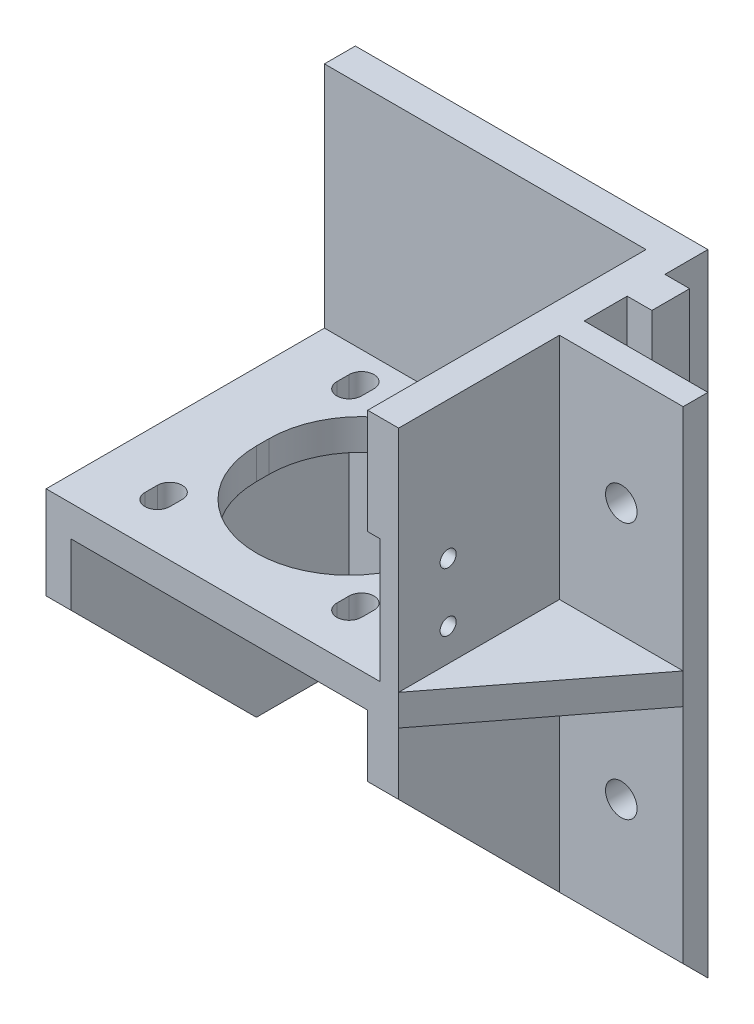
from build123d import *

# Parameters (mm, degrees)
SKETCH_1_W           = 57
SKETCH_1_H           = 50
EXTRUDE_1_DEPTH      = 5
EXTRUDE_3_DEPTH      = 30
EXTRUDE_4_DEPTH      = 40
CUT_EXTRUDE_1_DEPTH  = 80
SKETCH_6_R           = 15
CUT_EXTRUDE_2_DEPTH  = 80
SKETCH_7_R           = 3
CUT_EXTRUDE_6_DEPTH  = 80
SKETCH_8_W           = 6.1
SKETCH_8_H           = 75
EXTRUDE_5_DEPTH      = 4
EXTRUDE_6_DEPTH      = 20
SKETCH_10_W          = 20
SKETCH_10_H          = 5
EXTRUDE_7_DEPTH      = 26
CUT_EXTRUDE_7_DEPTH  = 26
EXTRUDE_8_DEPTH      = 7
SKETCH_15_R          = 2.55
CUT_EXTRUDE_9_DEPTH  = 7
SKETCH_16_W          = 5.535203569
SKETCH_16_H          = 7.819573295
SKETCH_16_W_2        = 5.974505439
SKETCH_16_H_2        = 8.127084604
SKETCH_16_W_3        = 7.643852547
SKETCH_16_H_3        = 8.522456287
SKETCH_16_W_4        = 7.380271425
SKETCH_16_H_4        = 8.083154417
EXTRUDE_9_DEPTH      = 5
CUT_EXTRUDE_10_DEPTH = 5
CUT_EXTRUDE_11_DEPTH = 5
SKETCH_19_R          = 3.05
CUT_EXTRUDE_12_DEPTH = 10
SKETCH_21_W          = 77
SKETCH_21_H          = 82
CUT_EXTRUDE_13_DEPTH = 50
SKETCH_22_W          = 80.624426437
SKETCH_22_H          = 78
CUT_EXTRUDE_14_DEPTH = 50
CUT_EXTRUDE_15_DEPTH = 10
SKETCH_24_W          = 2
SKETCH_24_H          = 20
CUT_EXTRUDE_16_DEPTH = 15
SKETCH_25_R          = 1.3
CUT_EXTRUDE_17_DEPTH = 15


with BuildPart() as part:
    # 草图1 → 凸台-拉伸1 (new body)
    with BuildSketch(Plane(origin=(0, 0, 0), x_dir=(1, 0, 0), z_dir=(0, 1, 0))):
        Rectangle(SKETCH_1_W, SKETCH_1_H)
    extrude_1 = extrude(amount=EXTRUDE_1_DEPTH)

    # 草图2 → 凸台-拉伸3 (add)
    with BuildSketch(Plane(origin=(0, 5, 0), x_dir=(1, 0, 0), z_dir=(0, 1, 0))):
        Polygon((-28.5, -25), (-23.5, -25), (-23.5, 20), (28.5, 20), (28.5, 25), (-28.5, 25), align=None)
    extrude_3 = extrude(amount=EXTRUDE_3_DEPTH)

    # 草图3 → 凸台-拉伸4 (add)
    with BuildSketch(Plane.XZ):
        Polygon((-28.5, -25), (28.5, -25), (28.5, 25), (24.5, 25), (24.5, -20), (-23.5, -20), (-23.5, 25), (-28.5, 25), align=None)
    extrude_4 = extrude(amount=EXTRUDE_4_DEPTH)

    # 草图5 → 切除-拉伸1 (cut)
    with BuildSketch(Plane(origin=(28.5, 0, 0), x_dir=(0, 0, -1), z_dir=(1, 0, 0))):
        Polygon((-25, -10), (5, -40), (-25, -40), align=None)
    cut_extrude_1 = extrude(amount=-CUT_EXTRUDE_1_DEPTH, mode=Mode.SUBTRACT)

    # 草图6 → 切除-拉伸2 (cut)
    with BuildSketch(Plane(origin=(0, 5, 0), x_dir=(1, 0, 0), z_dir=(0, 1, 0))):
        with BuildLine():
            Line((20.5, -19), (20.5, -17))
            ThreePointArc((20.5, -17), (18.5, -15), (16.5, -17))
            Line((16.5, -17), (16.5, -19))
            ThreePointArc((16.5, -19), (18.5, -21), (20.5, -19))
        make_face()
        with Locations((2.5, -1)):
            Circle(SKETCH_6_R)
        with BuildLine():
            Line((-15.5, -17), (-15.5, -19))
            ThreePointArc((-15.5, -19), (-13.5, -21), (-11.5, -19))
            Line((-11.5, -19), (-11.5, -17))
            ThreePointArc((-11.5, -17), (-13.5, -15), (-15.5, -17))
        make_face()
        with BuildLine():
            ThreePointArc((20.5, 13), (18.5, 15), (16.5, 13))
            Line((16.5, 13), (16.5, 11))
            ThreePointArc((16.5, 11), (18.5, 9), (20.5, 11))
            Line((20.5, 11), (20.5, 13))
        make_face()
        with BuildLine():
            Line((-11.5, 11), (-11.5, 13))
            ThreePointArc((-11.5, 13), (-13.5, 15), (-15.5, 13))
            Line((-15.5, 13), (-15.5, 11))
            ThreePointArc((-15.5, 11), (-13.5, 9), (-11.5, 11))
        make_face()
    extrude(amount=-CUT_EXTRUDE_2_DEPTH, mode=Mode.SUBTRACT)

    # 草图7 → 切除-拉伸6 (cut)
    with BuildSketch(Plane.XY.offset(-20)):
        with Locations((-15.5, 17)):
            Circle(SKETCH_7_R)
    extrude(amount=-CUT_EXTRUDE_6_DEPTH, mode=Mode.SUBTRACT)

    # 草图8 → 凸台-拉伸5 (add)
    with BuildSketch(Plane.ZY.offset(28.5)):
        with Locations((-15, -2.5)):
            Rectangle(SKETCH_8_W, SKETCH_8_H)
    extrude_5 = extrude(amount=EXTRUDE_5_DEPTH)

    # 草图9 → 凸台-拉伸6 (add)
    with BuildSketch(Plane.ZY.offset(28.5)):
        Polygon((-5, -40), (-5, 35), (-1, 35), (-1, -36), align=None)
    extrude_6 = extrude(amount=EXTRUDE_6_DEPTH)

    # 草图10 → 凸台-拉伸7 (add)
    with BuildSketch(Plane.XY.offset(-1)):
        with Locations((-38.5, 2.5)):
            Rectangle(SKETCH_10_W, SKETCH_10_H)
    extrude_7 = extrude(amount=EXTRUDE_7_DEPTH)

    # 草图11 → 切除-拉伸7 (cut)
    with BuildSketch(Plane.XZ):
        Polygon((-48.5, 25), (-48.5, -1), (-28.5, 25), align=None)
    cut_extrude_7 = extrude(amount=-CUT_EXTRUDE_7_DEPTH, mode=Mode.SUBTRACT)

    # 草图14 → 凸台-拉伸8 (add)
    with BuildSketch(Plane(origin=(0, 35, 0), x_dir=(1, 0, 0), z_dir=(0, 1, 0))):
        Polygon((28.5, 25), (-28.5, 25), (-28.5, 18.05), (-32.5, 18.05), (-32.5, 11.95), (-28.5, 11.95), (-28.5, 5), (-48.5, 5), (-48.5, 1), (-28.5, 1), (-28.5, -25), (-23.5, -25), (-23.5, 20), (28.5, 20), align=None)
    extrude_8 = extrude(amount=EXTRUDE_8_DEPTH)

    # 草图15 → 切除-拉伸9 (cut)
    with BuildSketch(Plane.XY.offset(-1)):
        with Locations((-38.5, 23.5)):
            Circle(SKETCH_15_R)
        with Locations((-38.5, -18)):
            Circle(SKETCH_15_R)
    cut_extrude_9 = extrude(amount=-CUT_EXTRUDE_9_DEPTH, mode=Mode.SUBTRACT)

    # 草图16 → 凸台-拉伸9 (add)
    with BuildSketch(Plane(origin=(0, 5, 0), x_dir=(1, 0, 0), z_dir=(0, 1, 0))):
        with Locations((-13.755717979, 12.566621799)):
            Rectangle(SKETCH_16_W, SKETCH_16_H)
        with Locations((-13.975368915, -17.503591238)):
            Rectangle(SKETCH_16_W_2, SKETCH_16_H_2)
        with Locations((18.884411, -17.70127708)):
            Rectangle(SKETCH_16_W_3, SKETCH_16_H_3)
        with Locations((18.752620439, 12.69841236)):
            Rectangle(SKETCH_16_W_4, SKETCH_16_H_4)
    extrude(amount=-EXTRUDE_9_DEPTH)

    # 草图17 → 切除-拉伸10 (cut)
    with BuildSketch(Plane(origin=(0, 5, 0), x_dir=(1, 0, 0), z_dir=(0, 1, 0))):
        with BuildLine():
            Line((17, 15.5), (17, 13.5))
            ThreePointArc((17, 13.5), (18, 12.5), (19, 13.5))
            Line((19, 13.5), (19, 15.5))
            ThreePointArc((19, 15.5), (18, 16.5), (17, 15.5))
        make_face()
        with BuildLine():
            Line((-14, 15.5), (-14, 13.5))
            ThreePointArc((-14, 13.5), (-13, 12.5), (-12, 13.5))
            Line((-12, 13.5), (-12, 15.5))
            ThreePointArc((-12, 15.5), (-13, 16.5), (-14, 15.5))
        make_face()
        with BuildLine():
            Line((17, -15.5), (17, -17.5))
            ThreePointArc((17, -17.5), (18, -18.5), (19, -17.5))
            Line((19, -17.5), (19, -15.5))
            ThreePointArc((19, -15.5), (18, -14.5), (17, -15.5))
        make_face()
        with BuildLine():
            Line((-14, -15.5), (-14, -17.5))
            ThreePointArc((-14, -17.5), (-13, -18.5), (-12, -17.5))
            Line((-12, -17.5), (-12, -15.5))
            ThreePointArc((-12, -15.5), (-13, -14.5), (-14, -15.5))
        make_face()
    cut_extrude_10 = extrude(amount=-CUT_EXTRUDE_10_DEPTH, mode=Mode.SUBTRACT)

    # 草图18 → 切除-拉伸11 (cut)
    with BuildSketch(Plane(origin=(0, 5, 0), x_dir=(1, 0, 0), z_dir=(0, 1, 0))):
        with BuildLine():
            Line((-12.5, -1), (-12.5, 0))
            ThreePointArc((-12.5, 0), (2.5, 15), (17.5, 0))
            Line((17.5, 0), (17.5, -1))
            Line((17.5, -1), (17.5, -2))
            ThreePointArc((17.5, -2), (2.5, -17), (-12.5, -2))
            Line((-12.5, -2), (-12.5, -1))
        make_face()
    cut_extrude_11 = extrude(amount=-CUT_EXTRUDE_11_DEPTH, mode=Mode.SUBTRACT)

    # 草图19 → 切除-拉伸12 (cut)
    with BuildSketch(Plane(origin=(0, 0, -25), x_dir=(-1, 0, 0), z_dir=(0, 0, -1))):
        with Locations((15.5, 17)):
            Circle(SKETCH_19_R)
    cut_extrude_12 = extrude(amount=-CUT_EXTRUDE_12_DEPTH, mode=Mode.SUBTRACT)

    # 镜向3: 凸台-拉伸1, 凸台-拉伸3, 凸台-拉伸4, 切除-拉伸1, 凸台-拉伸5, 凸台-拉伸6, 凸台-拉伸7, 切除-拉伸7, 凸台-拉伸8, 切除-拉伸9, 切除-拉伸10, 切除-拉伸11, 切除-拉伸12 across plane
    add(extrude_1.mirror(Plane(origin=(28.5, 5, 25), x_dir=(0, 0, 1), z_dir=(-1, 0, 0))))
    add(extrude_3.mirror(Plane(origin=(28.5, 5, 25), x_dir=(0, 0, 1), z_dir=(-1, 0, 0))))
    add(extrude_4.mirror(Plane(origin=(28.5, 5, 25), x_dir=(0, 0, 1), z_dir=(-1, 0, 0))))
    add(cut_extrude_1.mirror(Plane(origin=(28.5, 5, 25), x_dir=(0, 0, 1), z_dir=(-1, 0, 0))), mode=Mode.SUBTRACT)
    add(extrude_5.mirror(Plane(origin=(28.5, 5, 25), x_dir=(0, 0, 1), z_dir=(-1, 0, 0))))
    add(extrude_6.mirror(Plane(origin=(28.5, 5, 25), x_dir=(0, 0, 1), z_dir=(-1, 0, 0))))
    add(extrude_7.mirror(Plane(origin=(28.5, 5, 25), x_dir=(0, 0, 1), z_dir=(-1, 0, 0))))
    add(cut_extrude_7.mirror(Plane(origin=(28.5, 5, 25), x_dir=(0, 0, 1), z_dir=(-1, 0, 0))), mode=Mode.SUBTRACT)
    add(extrude_8.mirror(Plane(origin=(28.5, 5, 25), x_dir=(0, 0, 1), z_dir=(-1, 0, 0))))
    add(cut_extrude_9.mirror(Plane(origin=(28.5, 5, 25), x_dir=(0, 0, 1), z_dir=(-1, 0, 0))), mode=Mode.SUBTRACT)
    add(cut_extrude_10.mirror(Plane(origin=(28.5, 5, 25), x_dir=(0, 0, 1), z_dir=(-1, 0, 0))), mode=Mode.SUBTRACT)
    add(cut_extrude_11.mirror(Plane(origin=(28.5, 5, 25), x_dir=(0, 0, 1), z_dir=(-1, 0, 0))), mode=Mode.SUBTRACT)
    add(cut_extrude_12.mirror(Plane(origin=(28.5, 5, 25), x_dir=(0, 0, 1), z_dir=(-1, 0, 0))), mode=Mode.SUBTRACT)

    # 草图21 → 切除-拉伸13 (cut)
    with BuildSketch(Plane.XY.offset(-1)):
        with Locations((-10, 1)):
            Rectangle(SKETCH_21_W, SKETCH_21_H)
    extrude(amount=-CUT_EXTRUDE_13_DEPTH, mode=Mode.SUBTRACT)

    # 草图22 → 切除-拉伸14 (cut)
    with BuildSketch(Plane(origin=(0, 0, -1), x_dir=(-1, 0, 0), z_dir=(0, 0, -1))):
        with Locations((11.812213219, 3)):
            Rectangle(SKETCH_22_W, SKETCH_22_H)
    extrude(amount=-CUT_EXTRUDE_14_DEPTH, mode=Mode.SUBTRACT)

    # 草图23 → 切除-拉伸15 (cut)
    with BuildSketch(Plane(origin=(0, 5, 0), x_dir=(1, 0, 0), z_dir=(0, 1, 0))):
        with BuildLine():
            Line((41, 15.5), (41, 13.5))
            ThreePointArc((41, 13.5), (39, 11.5), (37, 13.5))
            Line((37, 13.5), (37, 15.5))
            ThreePointArc((37, 15.5), (39, 17.5), (41, 15.5))
        make_face()
        with BuildLine():
            Line((68, 15.5), (68, 13.5))
            ThreePointArc((68, 13.5), (70, 11.5), (72, 13.5))
            Line((72, 13.5), (72, 15.5))
            ThreePointArc((72, 15.5), (70, 17.5), (68, 15.5))
        make_face()
        with BuildLine():
            Line((41, -15.5), (41, -17.5))
            ThreePointArc((41, -17.5), (39, -19.5), (37, -17.5))
            Line((37, -17.5), (37, -15.5))
            ThreePointArc((37, -15.5), (39, -13.5), (41, -15.5))
        make_face()
        with BuildLine():
            Line((72, -15.5), (72, -17.5))
            ThreePointArc((72, -17.5), (70, -19.5), (68, -17.5))
            Line((68, -17.5), (68, -15.5))
            ThreePointArc((68, -15.5), (70, -13.5), (72, -15.5))
        make_face()
    extrude(amount=-CUT_EXTRUDE_15_DEPTH, mode=Mode.SUBTRACT)

    # 草图24 → 切除-拉伸16 (cut)
    with BuildSketch(Plane.XY.offset(25)):
        with Locations((81.5, 15)):
            Rectangle(SKETCH_24_W, SKETCH_24_H)
    extrude(amount=-CUT_EXTRUDE_16_DEPTH, mode=Mode.SUBTRACT)

    # 草图25 → 切除-拉伸17 (cut)
    with BuildSketch(Plane.ZY.offset(-82.5)):
        with Locations((17, 19.75)):
            Circle(SKETCH_25_R)
        with Locations((17, 10.25)):
            Circle(SKETCH_25_R)
    extrude(amount=-CUT_EXTRUDE_17_DEPTH, mode=Mode.SUBTRACT)


solid = part.part
